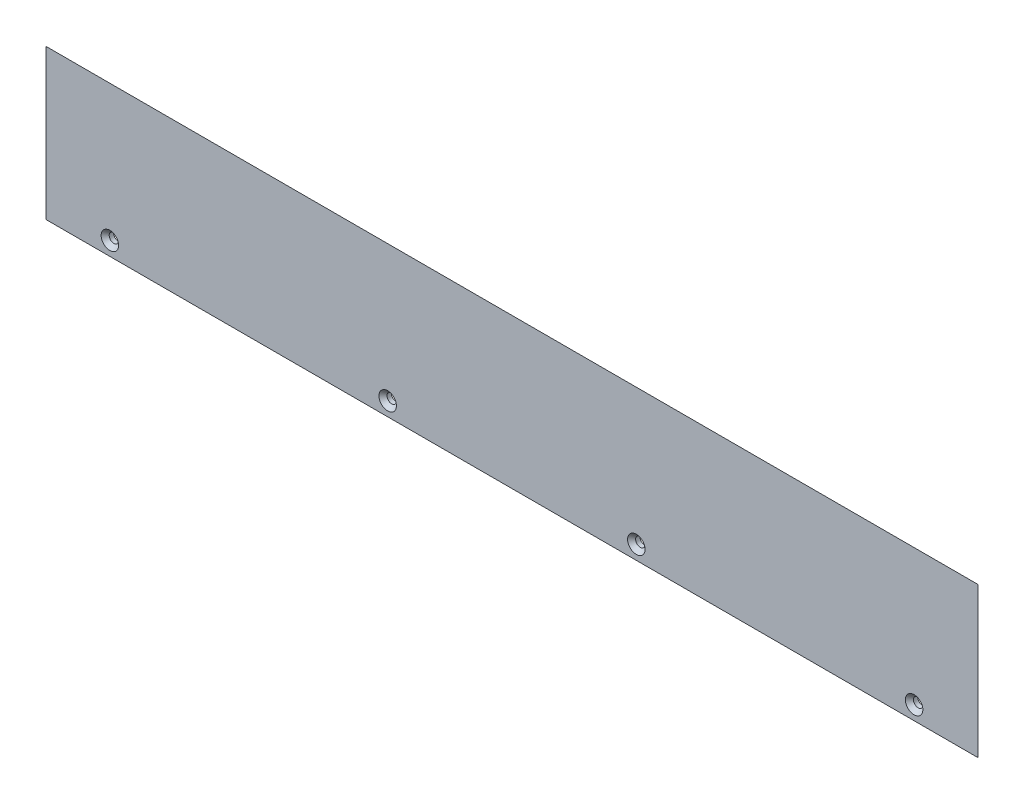
from build123d import *

# Parameters (mm, degrees)
SKETCH1_W                                      = 335.5
SKETCH1_H                                      = 54
BOSS_EXTRUDE1_DEPTH                            = 3
CHAMFER1_SIZE                                  = 3
CSK_FOR_M3_FLAT_HEAD_MACHINE_SCREW1_AT_2_COUNT = 2
CSK_FOR_M3_FLAT_HEAD_MACHINE_SCREW1_AT_2_PITCH = 100
CSK_FOR_M3_FLAT_HEAD_MACHINE_SCREW1_AT_3_COUNT = 2
CSK_FOR_M3_FLAT_HEAD_MACHINE_SCREW1_AT_3_PITCH = 189.5
CSK_FOR_M3_FLAT_HEAD_MACHINE_SCREW1_AT_4_COUNT = 2
CSK_FOR_M3_FLAT_HEAD_MACHINE_SCREW1_AT_4_PITCH = 289.5


with BuildPart() as part:
    # Sketch1 → Boss-Extrude1 (new body)
    with BuildSketch(Plane.XY):
        with Locations((167.75, 27)):
            Rectangle(SKETCH1_W, SKETCH1_H)
    extrude(amount=BOSS_EXTRUDE1_DEPTH)

    # Chamfer1
    chamfer1_edges = [part.edges().sort_by_distance(p)[0] for p in [
        (0, 27, 0),
        (167.75, 54, 0),
        (335.5, 27, 0),
    ]]
    chamfer(chamfer1_edges, length=CHAMFER1_SIZE - 0.0001)  # a hair under: the kernel refuses the full size

    # Sketch3 → CSK for M3 Flat Head Machine Screw1 (revolve, cut)
    with BuildSketch(Plane(origin=(23, 5, 3), x_dir=(0, -1, 0), z_dir=(1, 0, 0))):
        Polygon((0, 0), (0, 3), (1.7, 3), (1.7, 1.45), (3.15, 0), align=None)
    csk_for_m3_flat_head_machine_screw1 = revolve(axis=Axis((23, 5, 9.35), (0, 0, -1)), mode=Mode.SUBTRACT)

    # CSK for M3 Flat Head Machine Screw1 at 2: CSK for M3 Flat Head Machine Screw1 ×2
    with Locations(*[(i * CSK_FOR_M3_FLAT_HEAD_MACHINE_SCREW1_AT_2_PITCH, 0, 0) for i in range(1, CSK_FOR_M3_FLAT_HEAD_MACHINE_SCREW1_AT_2_COUNT)]):
        add(csk_for_m3_flat_head_machine_screw1, mode=Mode.SUBTRACT)

    # CSK for M3 Flat Head Machine Screw1 at 3: CSK for M3 Flat Head Machine Screw1 ×2
    with Locations(*[(i * CSK_FOR_M3_FLAT_HEAD_MACHINE_SCREW1_AT_3_PITCH, 0, 0) for i in range(1, CSK_FOR_M3_FLAT_HEAD_MACHINE_SCREW1_AT_3_COUNT)]):
        add(csk_for_m3_flat_head_machine_screw1, mode=Mode.SUBTRACT)

    # CSK for M3 Flat Head Machine Screw1 at 4: CSK for M3 Flat Head Machine Screw1 ×2
    with Locations(*[(i * CSK_FOR_M3_FLAT_HEAD_MACHINE_SCREW1_AT_4_PITCH, 0, 0) for i in range(1, CSK_FOR_M3_FLAT_HEAD_MACHINE_SCREW1_AT_4_COUNT)]):
        add(csk_for_m3_flat_head_machine_screw1, mode=Mode.SUBTRACT)


solid = part.part
